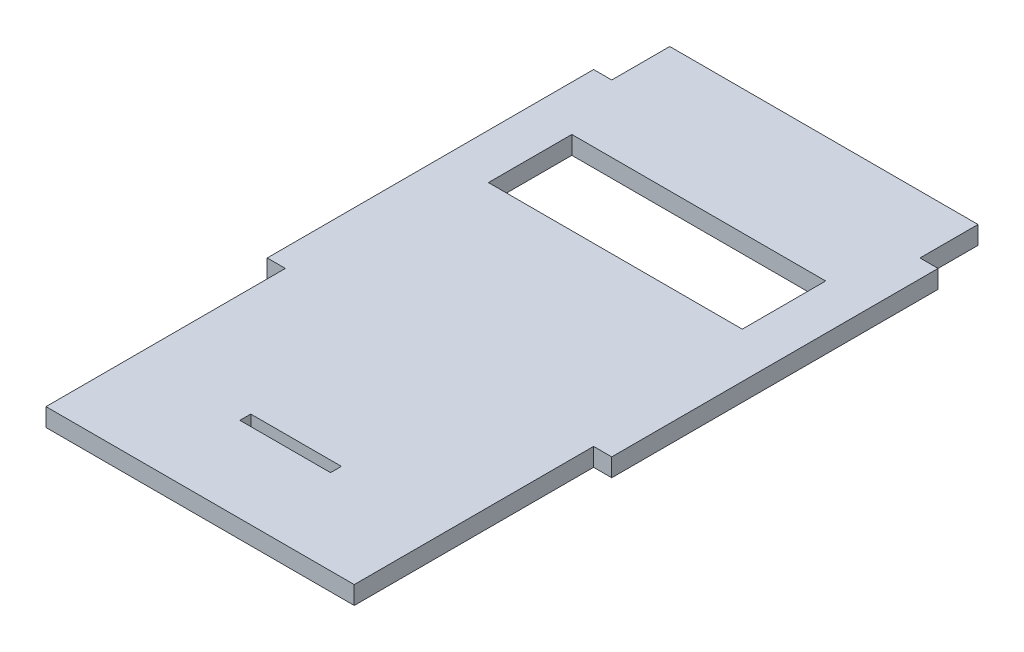
from build123d import *

# Parameters (mm, degrees)
CROQUIS1_W              = 25
CROQUIS1_H              = 3
CROQUIS1_W_2            = 70
CROQUIS1_H_2            = 23
SALIENTE_EXTRUIR1_DEPTH = 5


with BuildPart() as part:
    # Croquis1 → Saliente-Extruir1 (new body)
    with BuildSketch(Plane(origin=(0, 0, 0), x_dir=(1, 0, 0), z_dir=(0, 1, 0))):
        Polygon((-42.5, -86), (42.5, -86), (42.5, -20), (47.5, -20), (47.5, 70), (42.5, 70), (42.5, 86), (-42.5, 86), (-42.5, 70), (-47.5, 70), (-47.5, -20), (-42.5, -20), align=None)
        with Locations((0, -61.039633263)):
            Rectangle(CROQUIS1_W, CROQUIS1_H, mode=Mode.SUBTRACT)
        with Locations((0, 40)):
            Rectangle(CROQUIS1_W_2, CROQUIS1_H_2, mode=Mode.SUBTRACT)
    extrude(amount=SALIENTE_EXTRUIR1_DEPTH)


solid = part.part
